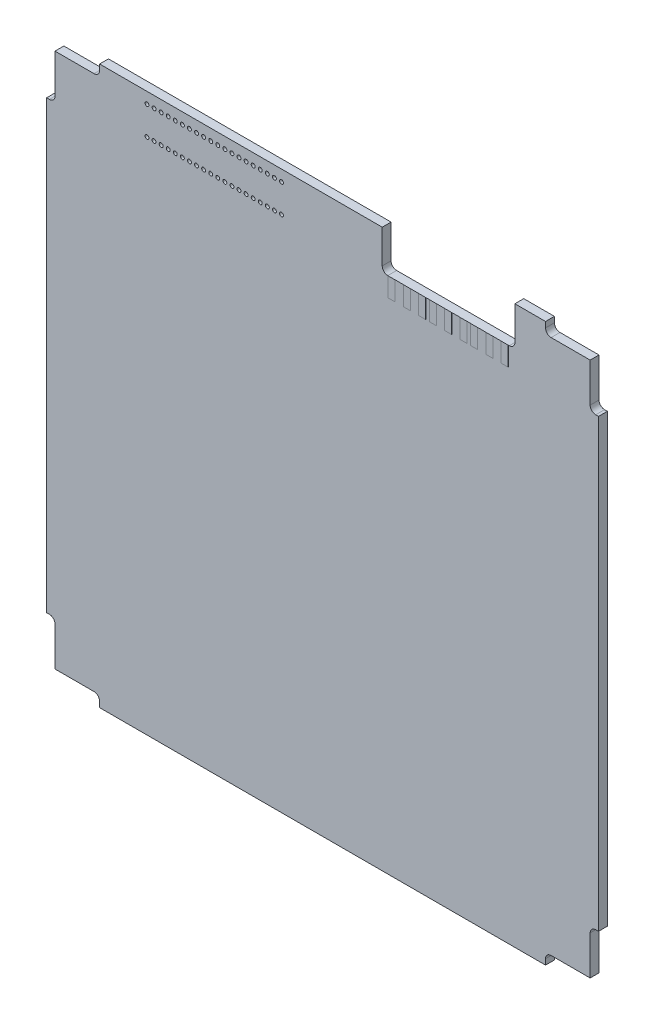
from build123d import *

# Parameters (mm, degrees)
BOSS_EXTRUDE1_DEPTH = 1.5875
FILLET1_R           = 1
SKETCH2_R           = 0.35
CUT_EXTRUDE1_DEPTH  = 71.728496069
CUT_EXTRUDE2_DEPTH  = 7.0216
FILLET2_R           = 1
SKETCH5_OUTSIDE_W   = 130.286
SKETCH5_OUTSIDE_H   = 130.286
SKETCH5_OUTSIDE_W_2 = 99
SKETCH5_OUTSIDE_H_2 = 100
CUT_EXTRUDE3_DEPTH  = 71.728496069
SKETCH6_W           = 1.27
SKETCH6_H           = 3.43
BOSS_EXTRUDE2_DEPTH = 0.01


with BuildPart() as part:
    # Sketch1 → Boss-Extrude1 (new body)
    with BuildSketch(Plane.XY):
        Polygon((40, 50), (-40, 50), (-40, 48), (-48, 48), (-48, 40), (-50, 40), (-50, -37.864895224), (-50, -40), (-48, -40), (-48, -48), (-40, -48), (-40, -50), (-37.864895224, -50), (40, -50), (40, -48), (48, -48), (48, -40), (50, -40), (50, 40), (48, 40), (48, 48), (40, 48), align=None)
    extrude(amount=BOSS_EXTRUDE1_DEPTH)

    # Fillet1
    fillet1_edges = [part.edges().sort_by_distance(p)[0] for p in [
        (-48, -40, 0.79375),
        (-40, -48, 0.79375),
        (40, -48, 0.79375),
        (48, -40, 0.79375),
        (48, 40, 0.79375),
        (40, 48, 0.79375),
        (-40, 48, 0.79375),
        (-48, 40, 0.79375),
    ]]
    fillet(fillet1_edges, radius=FILLET1_R)

    # Sketch2 → Cut-Extrude1 (cut, through all)
    with BuildSketch(Plane.XY.offset(1.5875)):
        with Locations((-31.5, 48)):
            Circle(SKETCH2_R)
        with Locations((-30.23, 48)):
            Circle(SKETCH2_R)
        with Locations((-28.96, 48)):
            Circle(SKETCH2_R)
        with Locations((-27.69, 48)):
            Circle(SKETCH2_R)
        with Locations((-26.42, 48)):
            Circle(SKETCH2_R)
        with Locations((-25.15, 48)):
            Circle(SKETCH2_R)
        with Locations((-23.88, 48)):
            Circle(SKETCH2_R)
        with Locations((-22.61, 48)):
            Circle(SKETCH2_R)
        with Locations((-21.34, 48)):
            Circle(SKETCH2_R)
        with Locations((-20.07, 48)):
            Circle(SKETCH2_R)
        with Locations((-18.8, 48)):
            Circle(SKETCH2_R)
        with Locations((-17.53, 48)):
            Circle(SKETCH2_R)
        with Locations((-16.26, 48)):
            Circle(SKETCH2_R)
        with Locations((-14.99, 48)):
            Circle(SKETCH2_R)
        with Locations((-13.72, 48)):
            Circle(SKETCH2_R)
        with Locations((-12.45, 48)):
            Circle(SKETCH2_R)
        with Locations((-11.18, 48)):
            Circle(SKETCH2_R)
        with Locations((-9.91, 48)):
            Circle(SKETCH2_R)
        with Locations((-8.64, 48)):
            Circle(SKETCH2_R)
        with Locations((-7.37, 48)):
            Circle(SKETCH2_R)
        with Locations((-30.23, 42.92)):
            Circle(SKETCH2_R)
        with Locations((-28.96, 42.92)):
            Circle(SKETCH2_R)
        with Locations((-27.69, 42.92)):
            Circle(SKETCH2_R)
        with Locations((-26.42, 42.92)):
            Circle(SKETCH2_R)
        with Locations((-25.15, 42.92)):
            Circle(SKETCH2_R)
        with Locations((-23.88, 42.92)):
            Circle(SKETCH2_R)
        with Locations((-22.61, 42.92)):
            Circle(SKETCH2_R)
        with Locations((-21.34, 42.92)):
            Circle(SKETCH2_R)
        with Locations((-20.07, 42.92)):
            Circle(SKETCH2_R)
        with Locations((-18.8, 42.92)):
            Circle(SKETCH2_R)
        with Locations((-17.53, 42.92)):
            Circle(SKETCH2_R)
        with Locations((-16.26, 42.92)):
            Circle(SKETCH2_R)
        with Locations((-14.99, 42.92)):
            Circle(SKETCH2_R)
        with Locations((-13.72, 42.92)):
            Circle(SKETCH2_R)
        with Locations((-12.45, 42.92)):
            Circle(SKETCH2_R)
        with Locations((-11.18, 42.92)):
            Circle(SKETCH2_R)
        with Locations((-9.91, 42.92)):
            Circle(SKETCH2_R)
        with Locations((-8.64, 42.92)):
            Circle(SKETCH2_R)
        with Locations((-7.37, 42.92)):
            Circle(SKETCH2_R)
        with Locations((-31.5, 42.92)):
            Circle(SKETCH2_R)
    extrude(amount=-CUT_EXTRUDE1_DEPTH, mode=Mode.SUBTRACT)

    # Sketch3 → Cut-Extrude2 (cut)
    with BuildSketch(Plane(origin=(0, 50, 0), x_dir=(1, 0, 0), z_dir=(0, 1, 0))):
        Polygon((10.7, 0), (19.7, 0), (34.5, 0), (34.5, -1.5875), (19.7, -1.5875), (10.7, -1.5875), align=None)
    extrude(amount=-CUT_EXTRUDE2_DEPTH, mode=Mode.SUBTRACT)

    # Fillet2
    fillet2_edges = [part.edges().sort_by_distance(p)[0] for p in [
        (10.7, 42.9784, 0.79375),
        (34.5, 42.9784, 0.79375),
    ]]
    fillet(fillet2_edges, radius=FILLET2_R)

    # Sketch5 outside → Cut-Extrude3 (cut, through all)
    with BuildSketch(Plane(origin=(0, 0, 0), x_dir=(-1, 0, 0), z_dir=(0, 0, -1))):
        Rectangle(SKETCH5_OUTSIDE_W, SKETCH5_OUTSIDE_H)
        Rectangle(SKETCH5_OUTSIDE_W_2, SKETCH5_OUTSIDE_H_2, mode=Mode.SUBTRACT)
    extrude(amount=-CUT_EXTRUDE3_DEPTH, mode=Mode.SUBTRACT)

    # Sketch6 → Boss-Extrude2 (add)
    with BuildSketch(Plane.XY.offset(1.5875)):
        with Locations((12.4, 41.2634)):
            Rectangle(SKETCH6_W, SKETCH6_H)
        with Locations((15.14, 41.2634)):
            Rectangle(SKETCH6_W, SKETCH6_H)
        with Locations((17.88, 41.2634)):
            Rectangle(SKETCH6_W, SKETCH6_H)
        with Locations((19.8, 41.2634)):
            Rectangle(SKETCH6_W, SKETCH6_H)
        with Locations((22.54, 41.2634)):
            Rectangle(SKETCH6_W, SKETCH6_H)
        with Locations((25.28, 41.2634)):
            Rectangle(SKETCH6_W, SKETCH6_H)
        with Locations((27.2, 41.2634)):
            Rectangle(SKETCH6_W, SKETCH6_H)
        with Locations((29.94, 41.2634)):
            Rectangle(SKETCH6_W, SKETCH6_H)
        with Locations((32.68, 41.2634)):
            Rectangle(SKETCH6_W, SKETCH6_H)
    extrude(amount=BOSS_EXTRUDE2_DEPTH)


solid = part.part
